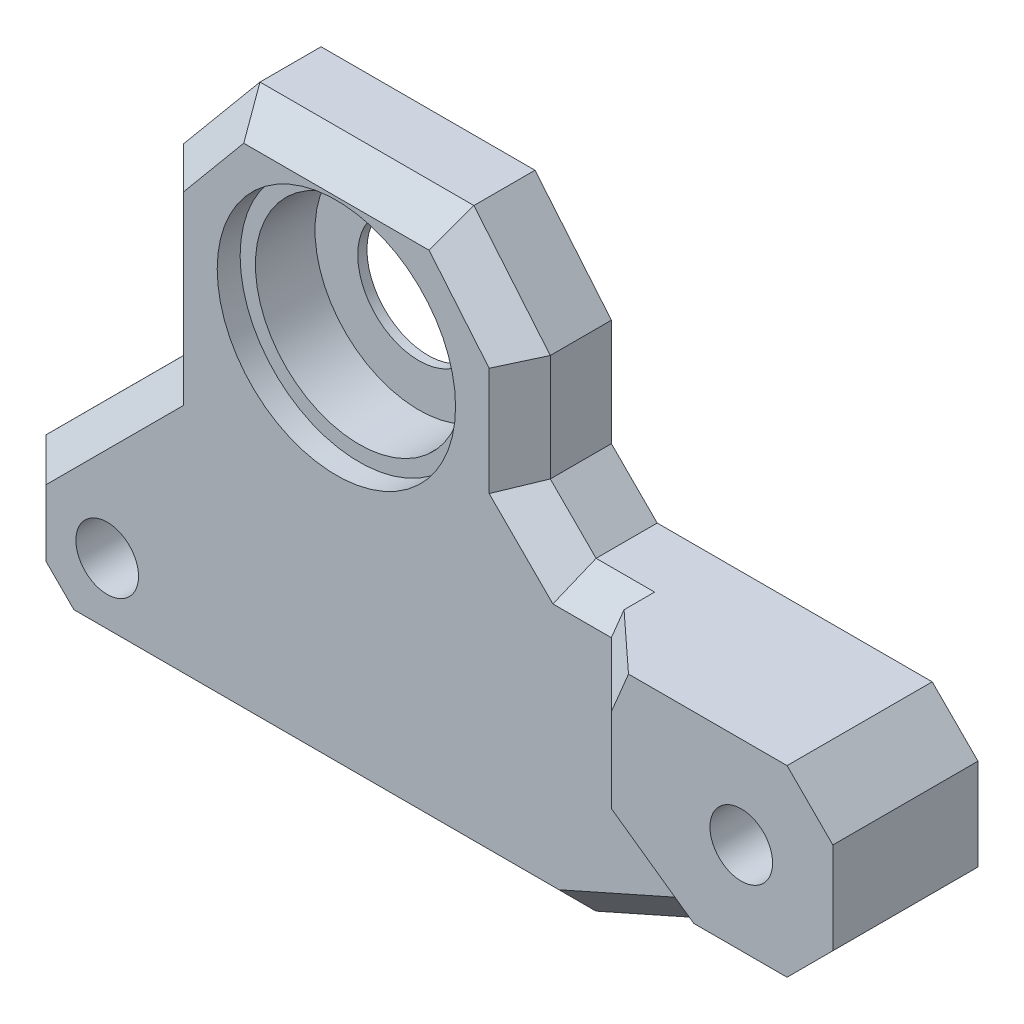
from build123d import *

# Parameters (mm, degrees)
BOSS_EXTRUDE1_DEPTH = 4
BOSS_EXTRUDE2_DEPTH = 2
BOSS_EXTRUDE2_DRAFT = 45
BOSS_EXTRUDE3_DEPTH = 5.5
SKETCH6_R           = 4
CUT_EXTRUDE1_DEPTH  = 18.5
SKETCH7_R           = 6.8
CUT_EXTRUDE2_DEPTH  = 5.4
SKETCH8_R           = 7.8
CUT_EXTRUDE3_DEPTH  = 1.5
SKETCH9_R           = 2.05
CUT_EXTRUDE4_DEPTH  = 15.5
SKETCH10_R          = 4
CUT_EXTRUDE5_DEPTH  = 2
SKETCH11_R          = 4
CUT_EXTRUDE6_DEPTH  = 2
CHAMFER4_SIZE       = 3.5


with BuildPart() as part:
    # Sketch1 → Boss-Extrude1 (new body)
    with BuildSketch(Plane.XY):
        Polygon((7, 15.536167626), (-7, 15.536167626), (-12, 9.536492635), (-12, -2.463507365), (-21.005602907, -11.463832374), (-21.005602907, -17.463832374), (-18.009338566, -20.463832374), (14.990661434, -20.463832374), (32.996264341, -12.45977287), (35.994397093, -9.461640117), (35.994397093, -3.461640117), (32.998132752, -0.461640117), (14.998132752, -0.461640117), (12, 2.536492635), (12, 9.536492635), align=None)
    extrude(amount=-BOSS_EXTRUDE1_DEPTH)


with BuildPart() as boss_extrude2_tool:
    # Sketch2 → Boss-Extrude2 (with draft: the straight prism first)
    with BuildSketch(Plane.XY):
        Polygon((7, 15.536167626), (-7, 15.536167626), (-12, 9.536492635), (-12, -2.463507365), (-21.005602907, -11.463832374), (-21.005602907, -17.463832374), (-18.009338566, -20.463832374), (14.990661434, -20.463832374), (32.996264341, -12.45977287), (35.994397093, -9.461640117), (35.994397093, -3.461640117), (32.998132752, -0.461640117), (14.998132752, -0.461640117), (12, 2.536492635), (12, 9.536492635), align=None)
    extrude(amount=BOSS_EXTRUDE2_DEPTH)
    # Boss-Extrude2: the draft: its side faces are tilted about the plane it starts from
    boss_extrude2_sides = [boss_extrude2_tool.faces().sort_by_distance(p)[0] for p in [
        (0, 15.536167626, 1),
        (-9.5, 12.536330131, 1),
        (-12, 3.536492635, 1),
        (-16.502801453, -6.963669869, 1),
        (-21.005602907, -14.463832374, 1),
        (-19.507470737, -18.963832374, 1),
        (-1.509338566, -20.463832374, 1),
        (23.993462887, -16.461802622, 1),
        (34.495330717, -10.960706493, 1),
        (35.994397093, -6.461640117, 1),
        (34.496264923, -1.961640117, 1),
        (23.998132752, -0.461640117, 1),
        (13.499066376, 1.037426259, 1),
        (12, 6.036492635, 1),
        (9.5, 12.536330131, 1),
    ]]
    draft(boss_extrude2_sides, Plane.XY, BOSS_EXTRUDE2_DRAFT)


with BuildPart() as part_1:
    add(part.part)

    # Boss-Extrude2: add boss_extrude2_tool
    add(boss_extrude2_tool.part)

    # Sketch4 → Boss-Extrude3 (add)
    with BuildSketch(Plane.XY):
        Polygon((32.996264341, -12.45977287), (20.826264341, -12.45977287), (17.996264341, -10.45977287), (17.996264341, -2.45977287), (18.828132752, -0.461640117), (32.998132752, -0.461640117), (35.994397093, -3.461640117), (35.994397093, -9.461640117), align=None)
    extrude(amount=BOSS_EXTRUDE3_DEPTH)

    # Sketch6 → Cut-Extrude1 (cut)
    with BuildSketch(Plane(origin=(0, 0, -4), x_dir=(-1, 0, 0), z_dir=(0, 0, -1))):
        with Locations((0, 5.54)):
            Circle(SKETCH6_R)
    extrude(amount=-CUT_EXTRUDE1_DEPTH, mode=Mode.SUBTRACT)

    # Sketch7 → Cut-Extrude2 (cut)
    with BuildSketch(Plane.XY.offset(2)):
        with Locations((0, 5.54)):
            Circle(SKETCH7_R)
    extrude(amount=-CUT_EXTRUDE2_DEPTH, mode=Mode.SUBTRACT)

    # Sketch8 → Cut-Extrude3 (cut)
    with BuildSketch(Plane.XY.offset(2)):
        with Locations((0, 5.54)):
            Circle(SKETCH8_R)
    extrude(amount=-CUT_EXTRUDE3_DEPTH, mode=Mode.SUBTRACT)

    # Sketch9 → Cut-Extrude4 (cut)
    with BuildSketch(Plane.XY.offset(5.5)):
        with Locations((-15, -14.46)):
            Circle(SKETCH9_R)
        with Locations((30, -6.46)):
            Circle(SKETCH9_R)
    extrude(amount=-CUT_EXTRUDE4_DEPTH, mode=Mode.SUBTRACT)

    # Sketch10 → Cut-Extrude5 (cut)
    with BuildSketch(Plane(origin=(0, 0, -4), x_dir=(-1, 0, 0), z_dir=(0, 0, -1))):
        with Locations((15, -14.46)):
            Circle(SKETCH10_R)
    extrude(amount=-CUT_EXTRUDE5_DEPTH, mode=Mode.SUBTRACT)

    # Sketch11 → Cut-Extrude6 (cut)
    with BuildSketch(Plane(origin=(0, 0, -4), x_dir=(-1, 0, 0), z_dir=(0, 0, -1))):
        with Locations((-30, -6.46)):
            Circle(SKETCH11_R)
    extrude(amount=-CUT_EXTRUDE6_DEPTH, mode=Mode.SUBTRACT)

    # Chamfer4
    chamfer4_edges = [part_1.edges().sort_by_distance(p)[0] for p in [
        (19.411264341, -11.45977287, 5.5),
        (18.412198547, -1.460706493, 5.5),
        (17.996264341, -6.45977287, 5.5),
    ]]
    chamfer(chamfer4_edges, length=CHAMFER4_SIZE - 0.0001)  # a hair under: the kernel refuses the full size


solid = part_1.part
